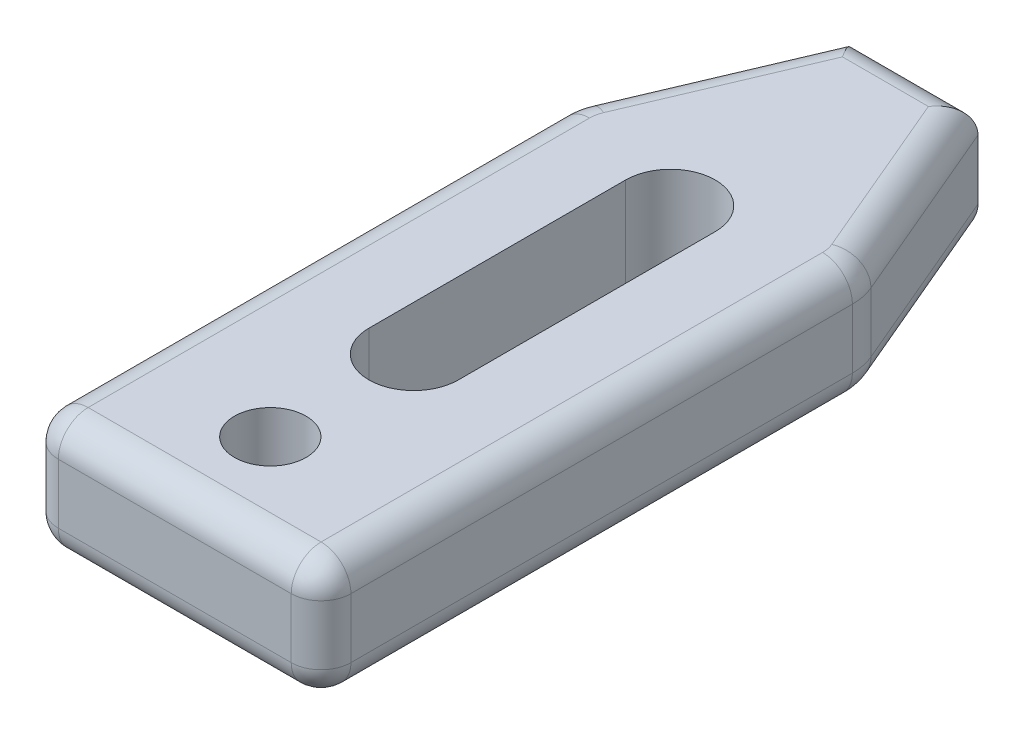
from build123d import *

# Parameters (mm, degrees)
SKETCH_1_W      = 49
SKETCH_1_H      = 32
SKETCH_1_R      = 6
EXTRUDE_1_DEPTH = 20
SKETCH_3_W      = 49
SKETCH_3_H      = 59
EXTRUDE_2_DEPTH = 20
FILLET_1_R      = 10
FILLET_2_R      = 5
FILLET_3_R      = 5
FILLET_4_R      = 5


with BuildPart() as part:
    # 草图1 → 凸台-拉伸1 (new body)
    with BuildSketch(Plane(origin=(0, 0, 0), x_dir=(1, 0, 0), z_dir=(0, 1, 0))):
        Rectangle(SKETCH_1_W, SKETCH_1_H)
        with Locations(Location((0, 0, 0), (0, 0, 270))):
            Circle(SKETCH_1_R, mode=Mode.SUBTRACT)
    extrude(amount=EXTRUDE_1_DEPTH)

    # 草图3 → 凸台-拉伸2 (add)
    # profile 1 of 2: a face of its own
    with BuildSketch(Plane(origin=(0, 0, 0), x_dir=(1, 0, 0), z_dir=(0, 1, 0))):
        with Locations((0, 45.5)):
            Rectangle(SKETCH_3_W, SKETCH_3_H)
        with BuildLine():
            ThreePointArc((-7.5, 24), (0, 16.5), (7.5, 24))
            Line((7.5, 24), (7.5, 67))
            ThreePointArc((7.5, 67), (0, 74.5), (-7.5, 67))
            Line((-7.5, 67), (-7.5, 24))
        make_face(mode=Mode.SUBTRACT)
    # profile 2 of 2: a face of its own
    with BuildSketch(Plane(origin=(0, 0, 0), x_dir=(1, 0, 0), z_dir=(0, 1, 0))):
        Polygon((10.5, 108), (24.5, 75), (-24.5, 75), (-10.5, 108), align=None)
    extrude(amount=EXTRUDE_2_DEPTH)

    # 圆角1
    fillet_1_edges = [part.edges().sort_by_distance(p)[0] for p in [
        (-24.5, 10, -75),
        (24.5, 10, -75),
    ]]
    fillet(fillet_1_edges, radius=FILLET_1_R)

    # 圆角2
    fillet_2_edges = [part.edges().sort_by_distance(p)[0] for p in [
        (24.5, 20, -28.483251194),
        (17.102908909, 20, -92.436000428),
        (0, 20, -108),
        (-17.102908909, 0, -92.436000428),
        (-17.102908909, 20, -92.436000428),
        (0, 0, -108),
        (17.102908909, 0, -92.436000428),
        (-24.5, 0, -28.483251194),
        (-24.299443305, 0, -74.959216844),
        (24.299443305, 0, -74.959216844),
        (-24.5, 20, -28.483251194),
        (-24.299443305, 20, -74.959216844),
        (24.299443305, 20, -74.959216844),
        (24.5, 0, -28.483251194),
        (24.5, 10, 16),
        (-24.5, 10, 16),
    ]]
    fillet(fillet_2_edges, radius=FILLET_2_R)

    # 圆角3
    # the kernel refuses this fillet: 5 mm, written as the material it takes off along each edge
    with BuildSketch(Plane(origin=(-19.5, 15, 11), x_dir=(0, 0, 1), z_dir=(0, 1, 0))) as fillet_3_piece_1_section:
        Polygon((0, 0), (FILLET_3_R, 0), (FILLET_3_R, -FILLET_3_R), (0, -FILLET_3_R), align=None)
    fillet_3_piece_1 = extrude(amount=FILLET_3_R, mode=Mode.PRIVATE)
    fillet_3_piece_1 = fillet_3_piece_1 - Plane(origin=(-19.5, 15, 11), x_dir=(0.7071067811865475, 0, -0.7071067811865475), z_dir=(0, 1, 0)) * Sphere(FILLET_3_R, mode=Mode.PRIVATE)
    add(fillet_3_piece_1, mode=Mode.SUBTRACT)
    with BuildSketch(Plane(origin=(19.5, 15, 11), x_dir=(0, 0, 1), z_dir=(0, 1, 0))) as fillet_3_piece_2_section:
        Polygon((0, 0), (FILLET_3_R, 0), (FILLET_3_R, FILLET_3_R), (0, FILLET_3_R), align=None)
    fillet_3_piece_2 = extrude(amount=FILLET_3_R, mode=Mode.PRIVATE)
    fillet_3_piece_2 = fillet_3_piece_2 - Plane(origin=(19.5, 15, 11), x_dir=(-0.7071067811865475, 0, -0.7071067811865475), z_dir=(0, 1, 0)) * Sphere(FILLET_3_R, mode=Mode.PRIVATE)
    add(fillet_3_piece_2, mode=Mode.SUBTRACT)
    with BuildSketch(Plane(origin=(-19.5, 20, 16), x_dir=(0, 0, -1), z_dir=(1, 0, 0))) as fillet_3_piece_3:
        with BuildLine():
            CenterArc((FILLET_3_R, -FILLET_3_R), FILLET_3_R, 90, 90)
            Line((0, -FILLET_3_R), (0, 0))
            Line((0, 0), (FILLET_3_R, 0))
        make_face()
    extrude(amount=39, mode=Mode.SUBTRACT)

    # 圆角4
    # the kernel refuses this fillet: 5 mm, written as the material it takes off along each edge
    with BuildSketch(Plane(origin=(-19.5, 5, 11), x_dir=(0, -1, 0), z_dir=(0, 0, 1))) as fillet_4_piece_1_section:
        Polygon((0, 0), (FILLET_4_R, 0), (FILLET_4_R, -FILLET_4_R), (0, -FILLET_4_R), align=None)
    fillet_4_piece_1 = extrude(amount=FILLET_4_R, mode=Mode.PRIVATE)
    fillet_4_piece_1 = fillet_4_piece_1 - Plane(origin=(-19.5, 5, 11), x_dir=(0.7071067811865475, 0.7071067811865475, 0), z_dir=(0, 0, 1)) * Sphere(FILLET_4_R, mode=Mode.PRIVATE)
    add(fillet_4_piece_1, mode=Mode.SUBTRACT)
    with BuildSketch(Plane(origin=(19.5, 5, 11), x_dir=(0, -1, 0), z_dir=(0, 0, 1))) as fillet_4_piece_2_section:
        Polygon((0, 0), (FILLET_4_R, 0), (FILLET_4_R, FILLET_4_R), (0, FILLET_4_R), align=None)
    fillet_4_piece_2 = extrude(amount=FILLET_4_R, mode=Mode.PRIVATE)
    fillet_4_piece_2 = fillet_4_piece_2 - Plane(origin=(19.5, 5, 11), x_dir=(-0.7071067811865475, 0.7071067811865475, 0), z_dir=(0, 0, 1)) * Sphere(FILLET_4_R, mode=Mode.PRIVATE)
    add(fillet_4_piece_2, mode=Mode.SUBTRACT)
    with BuildSketch(Plane(origin=(-19.5, 0, 16), x_dir=(0, 1, 0), z_dir=(1, 0, 0))) as fillet_4_piece_3:
        with BuildLine():
            CenterArc((FILLET_4_R, -FILLET_4_R), FILLET_4_R, 90, 90)
            Line((0, -FILLET_4_R), (0, 0))
            Line((0, 0), (FILLET_4_R, 0))
        make_face()
    extrude(amount=39, mode=Mode.SUBTRACT)


solid = part.part
